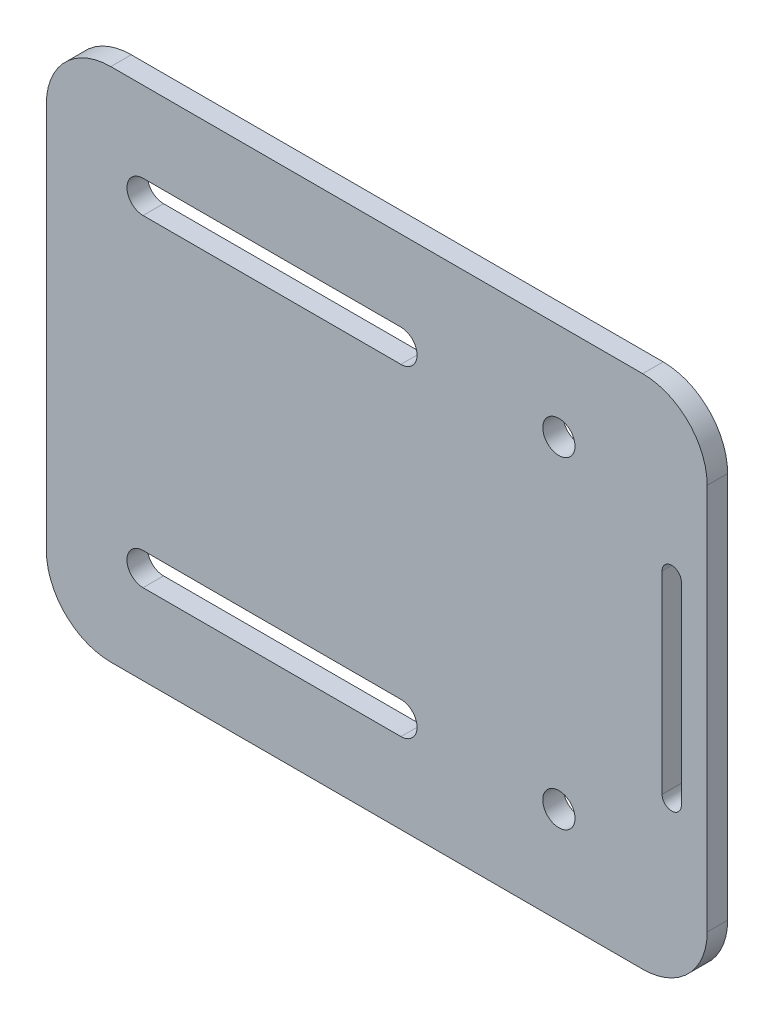
from build123d import *

# Parameters (mm, degrees)
SKETCH1_W           = 102.5
SKETCH1_H           = 80
SKETCH1_R           = 2.5
BOSS_EXTRUDE1_DEPTH = 3.175
FILLET1_R           = 10


with BuildPart() as part:
    # Sketch1 → Boss-Extrude1 (new body)
    with BuildSketch(Plane.XY):
        with Locations((-28.25, 0)):
            Rectangle(SKETCH1_W, SKETCH1_H)
        with Locations((0, 25)):
            Circle(SKETCH1_R, mode=Mode.SUBTRACT)
        with Locations((0, -25)):
            Circle(SKETCH1_R, mode=Mode.SUBTRACT)
        with BuildLine():
            Line((-64.5, -27.5), (-24.5, -27.5))
            ThreePointArc((-24.5, -27.5), (-22, -25), (-24.5, -22.5))
            Line((-24.5, -22.5), (-64.5, -22.5))
            ThreePointArc((-64.5, -22.5), (-67, -25), (-64.5, -27.5))
        make_face(mode=Mode.SUBTRACT)
        with BuildLine():
            Line((-64.5, 27.5), (-24.5, 27.5))
            ThreePointArc((-24.5, 27.5), (-22, 25), (-24.5, 22.5))
            Line((-24.5, 22.5), (-64.5, 22.5))
            ThreePointArc((-64.5, 22.5), (-67, 25), (-64.5, 27.5))
        make_face(mode=Mode.SUBTRACT)
        with BuildLine():
            Line((19, 15), (19, -15))
            ThreePointArc((19, -15), (17.5, -16.5), (16, -15))
            Line((16, -15), (16, 15))
            ThreePointArc((16, 15), (17.5, 16.5), (19, 15))
        make_face(mode=Mode.SUBTRACT)
    extrude(amount=BOSS_EXTRUDE1_DEPTH)

    # Fillet1
    fillet1_edges = [part.edges().sort_by_distance(p)[0] for p in [
        (23, 40, 1.5875),
        (23, -40, 1.5875),
        (-79.5, -40, 1.5875),
        (-79.5, 40, 1.5875),
    ]]
    fillet(fillet1_edges, radius=FILLET1_R)


solid = part.part
